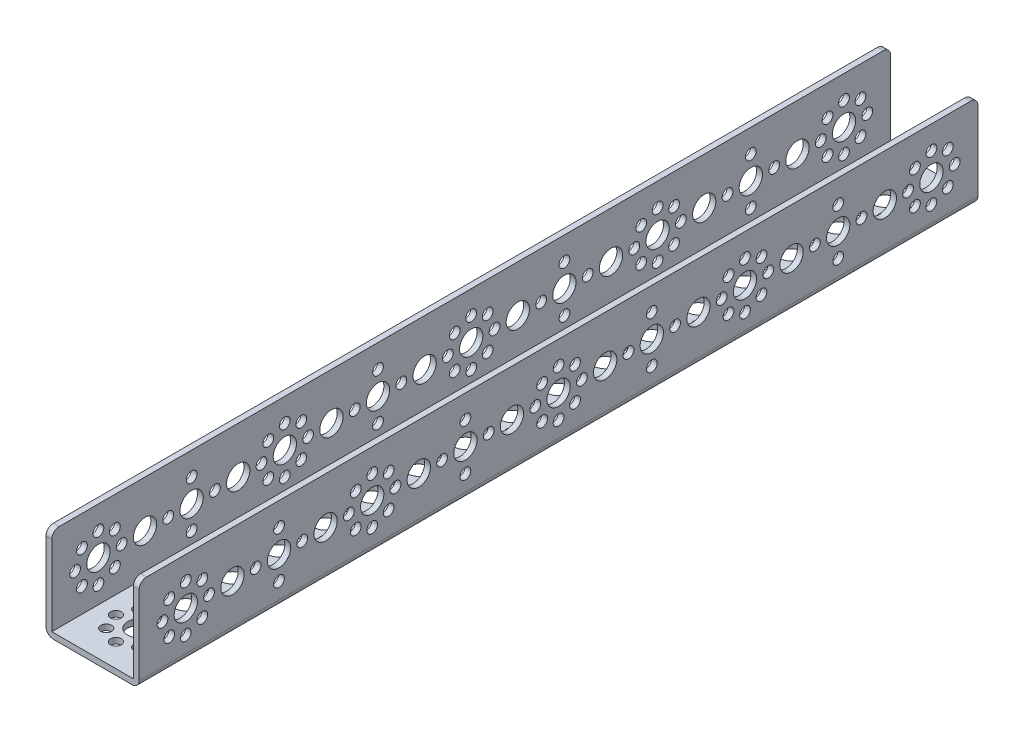
from build123d import *

# Parameters (mm, degrees)
SKETCH1_W                      = 288
SKETCH1_H                      = 32
BOSS_EXTRUDE1_DEPTH            = 32
SKETCH2_W                      = 28
SKETCH2_H                      = 30
CUT_EXTRUDE1_DEPTH             = 291.213714355
F_8_0_8_DIAMETER_HOLE1_D       = 8
F_8_0_8_DIAMETER_HOLE1_DEPTH   = 2
F_3_7_3_7_DIAMETER_HOLE1_D     = 3.7
F_3_7_3_7_DIAMETER_HOLE1_DEPTH = 2
F_3_7_3_7_DIAMETER_HOLE2_D     = 3.7
F_3_7_3_7_DIAMETER_HOLE2_DEPTH = 32
F_8_0_8_DIAMETER_HOLE2_D       = 8
F_8_0_8_DIAMETER_HOLE2_DEPTH   = 32
F_8_0_8_DIAMETER_HOLE3_D       = 8
F_8_0_8_DIAMETER_HOLE4_D       = 8
F_8_0_8_DIAMETER_HOLE4_DEPTH   = 32
F_3_7_3_7_DIAMETER_HOLE3_D     = 3.7
F_3_7_3_7_DIAMETER_HOLE3_DEPTH = 32
FILLET1_R                      = 2.5


with BuildPart() as part:
    # Sketch1 → Boss-Extrude1 (new body)
    with BuildSketch(Plane(origin=(16, 0, 0), x_dir=(0, 0, -1), z_dir=(1, 0, 0))):
        with Locations((128, 16)):
            Rectangle(SKETCH1_W, SKETCH1_H)
    extrude(amount=-BOSS_EXTRUDE1_DEPTH)

    # Sketch2 → Cut-Extrude1 (cut, through all)
    with BuildSketch(Plane(origin=(0, 0, -272), x_dir=(-1, 0, 0), z_dir=(0, 0, -1))):
        with Locations((0, 17)):
            Rectangle(SKETCH2_W, SKETCH2_H)
    extrude(amount=-CUT_EXTRUDE1_DEPTH, mode=Mode.SUBTRACT)

    # Ø8.0 (8) Diameter Hole1
    with Locations(Plane.ZY.offset(16)):
        with Locations((-64, 16), (-128, 16), (-192, 16), (-256, 16), (-32, 16), (-96, 16), (-160, 16), (-224, 16), (-16, 16), (-48, 16), (-80, 16), (-112, 16), (0, 16), (-144, 16), (-176, 16), (-208, 16), (-240, 16)):
            Hole(F_8_0_8_DIAMETER_HOLE1_D / 2, depth=F_8_0_8_DIAMETER_HOLE1_DEPTH)

    # Ø3.7 (3.7) Diameter Hole1
    with Locations(Plane.ZY.offset(16)):
        with Locations((0, 24), (0, 8), (-8, 16), (8, 16), (-5.656854249, 21.656854249), (5.656854249, 21.656854249), (5.656854249, 10.343145751), (-5.656854249, 10.343145751), (-64, 24), (-64, 8), (-72, 16), (-56, 16), (-69.656854249, 21.656854249), (-58.343145751, 21.656854249), (-58.343145751, 10.343145751), (-69.656854249, 10.343145751), (-128, 24), (-128, 8), (-136, 16), (-120, 16), (-133.656854249, 21.656854249), (-122.34314575, 21.656854249), (-122.34314575, 10.343145751), (-133.656854249, 10.343145751), (-192, 24), (-192, 8), (-200, 16), (-184, 16), (-197.656854249, 21.656854249), (-186.343145751, 21.656854249), (-186.343145751, 10.343145751), (-197.656854249, 10.343145751), (-256, 24), (-256, 8), (-264, 16), (-248, 16), (-261.656854249, 21.656854249), (-250.343145751, 21.656854249), (-250.343145751, 10.343145751), (-261.656854249, 10.343145751), (-32, 24), (-40, 16), (-32, 8), (-24, 16), (-96, 24), (-104, 16), (-96, 8), (-88, 16), (-160, 24), (-168, 16), (-160, 8), (-152, 16), (-224, 24), (-232, 16), (-224, 8), (-216, 16)):
            Hole(F_3_7_3_7_DIAMETER_HOLE1_D / 2, depth=F_3_7_3_7_DIAMETER_HOLE1_DEPTH)

    # Ø3.7 (3.7) Diameter Hole2
    with Locations(Plane(origin=(0, 0, 0), x_dir=(-1, 0, 0), z_dir=(0, -1, 0))):
        with Locations((8, 0), (5.656854249, 5.656854249), (0, 8), (-5.656854249, 5.656854249), (-8, 0), (-5.656854249, -5.656854249), (0, -8), (5.656854249, -5.656854249), (8, 64), (5.656854249, 69.656854249), (0, 72), (-5.656854249, 69.656854249), (-8, 64), (-5.656854249, 58.343145751), (0, 56), (5.656854249, 58.343145751), (8, 128), (5.656854249, 133.656854249), (0, 136), (-5.656854249, 133.656854249), (-8, 128), (-5.656854249, 122.34314575), (0, 120), (5.656854249, 122.34314575), (8, 192), (5.656854249, 197.656854249), (0, 200), (-5.656854249, 197.656854249), (-8, 192), (-5.656854249, 186.343145751), (0, 184), (5.656854249, 186.343145751), (8, 256), (5.656854249, 261.656854249), (0, 264), (-5.656854249, 261.656854249), (-8, 256), (-5.656854249, 250.343145751), (0, 248), (5.656854249, 250.343145751), (8, 32), (0, 40), (-8, 32), (0, 24), (8, 96), (0, 104), (-8, 96), (0, 88), (8, 160), (0, 168), (-8, 160), (0, 152), (8, 224), (0, 232), (-8, 224), (0, 216)):
            Hole(F_3_7_3_7_DIAMETER_HOLE2_D / 2, depth=F_3_7_3_7_DIAMETER_HOLE2_DEPTH)

    # Ø8.0 (8) Diameter Hole2
    with Locations(Plane(origin=(0, 0, 0), x_dir=(-1, 0, 0), z_dir=(0, -1, 0))):
        with Locations((0, 0), (0, 64), (0, 128), (0, 192), (0, 256), (0, 32), (0, 96), (0, 160), (0, 224), (0, 16), (0, 48), (0, 80), (0, 112), (0, 144), (0, 176), (0, 208), (0, 240)):
            Hole(F_8_0_8_DIAMETER_HOLE2_D / 2, depth=F_8_0_8_DIAMETER_HOLE2_DEPTH)

    # Ø8.0 (8) Diameter Hole3 (through all)
    with Locations(Plane.ZY.offset(-14)):
        with Locations((-32, 16)):
            Hole(F_8_0_8_DIAMETER_HOLE3_D / 2)

    # Ø8.0 (8) Diameter Hole4
    with Locations(Plane(origin=(16, 0, 0), x_dir=(0, 0, -1), z_dir=(1, 0, 0))):
        with Locations((64, 16), (128, 16), (192, 16), (256, 16), (96, 16), (160, 16), (224, 16), (16, 16), (48, 16), (80, 16), (112, 16), (0, 16), (144, 16), (176, 16), (208, 16), (240, 16)):
            Hole(F_8_0_8_DIAMETER_HOLE4_D / 2, depth=F_8_0_8_DIAMETER_HOLE4_DEPTH)

    # Ø3.7 (3.7) Diameter Hole3
    with Locations(Plane(origin=(16, 0, 0), x_dir=(0, 0, -1), z_dir=(1, 0, 0))):
        with Locations((0, 24), (0, 8), (8, 16), (-8, 16), (5.656854249, 21.656854249), (-5.656854249, 21.656854249), (-5.656854249, 10.343145751), (5.656854249, 10.343145751), (64, 24), (64, 8), (72, 16), (56, 16), (69.656854249, 21.656854249), (58.343145751, 21.656854249), (58.343145751, 10.343145751), (69.656854249, 10.343145751), (128, 24), (128, 8), (136, 16), (120, 16), (133.656854249, 21.656854249), (122.34314575, 21.656854249), (122.34314575, 10.343145751), (133.656854249, 10.343145751), (192, 24), (192, 8), (200, 16), (184, 16), (197.656854249, 21.656854249), (186.343145751, 21.656854249), (186.343145751, 10.343145751), (197.656854249, 10.343145751), (256, 24), (256, 8), (264, 16), (248, 16), (261.656854249, 21.656854249), (250.343145751, 21.656854249), (250.343145751, 10.343145751), (261.656854249, 10.343145751), (32, 24), (40, 16), (32, 8), (24, 16), (96, 24), (104, 16), (96, 8), (88, 16), (160, 24), (168, 16), (160, 8), (152, 16), (224, 24), (232, 16), (224, 8), (216, 16)):
            Hole(F_3_7_3_7_DIAMETER_HOLE3_D / 2, depth=F_3_7_3_7_DIAMETER_HOLE3_DEPTH)

    # Fillet1
    fillet1_edges = [part.edges().sort_by_distance(p)[0] for p in [
        (-16, 0, -128),
        (-15, 32, -272),
        (-15, 32, 16),
        (16, 0, -128),
        (15, 32, 16),
        (15, 32, -272),
    ]]
    fillet(fillet1_edges, radius=FILLET1_R)


solid = part.part
